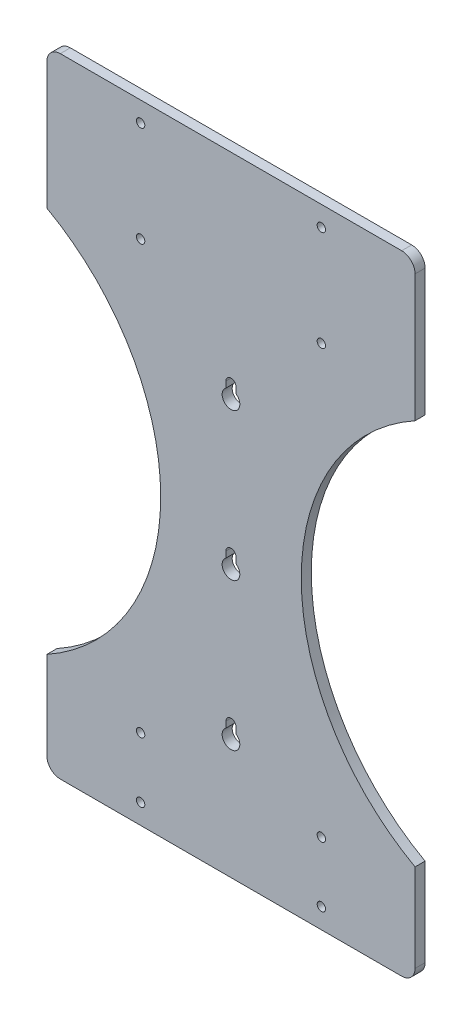
from build123d import *

# Parameters (mm, degrees)
BOSS_EXTRUDE1_DEPTH            = 9.525
V_0_377_DIAMETER_SLOT1_DEPTH   = 9.525
FILLET1_R                      = 12.7
SKETCH6_R                      = 8.382
CUT_EXTRUDE1_DEPTH             = 357.929879318
F_5_16_0_3125_DIAMETER_HOLE1_D = 7.9375
SKETCH14_W                     = 349.25
SKETCH14_H                     = 26.277954941
CUT_EXTRUDE3_DEPTH             = 357.929879318
FILLET2_R                      = 12.7


# Read off the part's stored shape, not the designer's step: V (0.377) Diameter Slot1
with BuildPart() as part:
    # Sketch1 → Boss-Extrude1 (new body)
    with BuildSketch(Plane.XY):
        with BuildLine():
            Line((-174.625, 151.522045059), (-174.625, 311.15))
            Line((-174.625, 311.15), (174.625, 311.15))
            Line((174.625, 311.15), (174.625, 151.522045059))
            ThreePointArc((174.625, 151.522045059), (66.675, -31.75), (174.625, -215.022045059))
            Line((174.625, -215.022045059), (174.625, -311.15))
            Line((174.625, -311.15), (-174.625, -311.15))
            Line((-174.625, -311.15), (-174.625, -215.022045059))
            ThreePointArc((-174.625, -215.022045059), (-66.675, -31.75), (-174.625, 151.522045059))
        make_face()
    extrude(amount=BOSS_EXTRUDE1_DEPTH)

    # V (0.377) Diameter Slot1 outline → V (0.377) Diameter Slot1 (cut)
    with BuildSketch(Plane.XY):
        with BuildLine():
            Line((4.7879, -57.8866), (4.7879, -45.2374))
            ThreePointArc((4.7879, -45.2374), (0, -40.4495), (-4.7879, -45.2374))
            Line((-4.7879, -45.2374), (-4.7879, -57.8866))
            ThreePointArc((-4.7879, -57.8866), (0, -62.6745), (4.7879, -57.8866))
        make_face()
        with BuildLine():
            ThreePointArc((4.7879, 94.4626), (0, 99.2505), (-4.7879, 94.4626))
            Line((-4.7879, 94.4626), (-4.7879, 81.8134))
            ThreePointArc((-4.7879, 81.8134), (0, 77.0255), (4.7879, 81.8134))
            Line((4.7879, 81.8134), (4.7879, 94.4626))
        make_face()
        with BuildLine():
            ThreePointArc((4.7879, -184.9374), (0, -180.1495), (-4.7879, -184.9374))
            Line((-4.7879, -184.9374), (-4.7879, -197.5866))
            ThreePointArc((-4.7879, -197.5866), (0, -202.3745), (4.7879, -197.5866))
            Line((4.7879, -197.5866), (4.7879, -184.9374))
        make_face()
    extrude(amount=V_0_377_DIAMETER_SLOT1_DEPTH, mode=Mode.SUBTRACT)

    # Fillet1
    fillet1_edges = [part.edges().sort_by_distance(p)[0] for p in [
        (174.625, -311.15, 4.7625),
        (-174.625, -311.15, 4.7625),
    ]]
    fillet(fillet1_edges, radius=FILLET1_R)

    # Sketch6 → Cut-Extrude1 (cut, through all)
    with BuildSketch(Plane.XY.offset(9.525)):
        with Locations((0, -197.5866)):
            Circle(SKETCH6_R)
        with Locations((0, 81.8134)):
            Circle(SKETCH6_R)
        with Locations((0, -57.8866)):
            Circle(SKETCH6_R)
    extrude(amount=-CUT_EXTRUDE1_DEPTH, mode=Mode.SUBTRACT)

    # 5/16 (0.3125) Diameter Hole1 (through all)
    with Locations(Plane(origin=(0, 0, 0), x_dir=(-1, 0, 0), z_dir=(0, 0, -1))):
        with Locations((-85.725, 265.938), (85.725, 170.688), (85.725, 265.938), (-85.725, 170.688), (85.725, -234.95), (85.725, -292.1), (-85.725, -292.1), (-85.725, -234.95)):
            Hole(F_5_16_0_3125_DIAMETER_HOLE1_D / 2)

    # Sketch14 → Cut-Extrude3 (cut, through all)
    with BuildSketch(Plane(origin=(0, 0, 0), x_dir=(-1, 0, 0), z_dir=(0, 0, -1))):
        with Locations((0, 298.011022529)):
            Rectangle(SKETCH14_W, SKETCH14_H)
    extrude(amount=-CUT_EXTRUDE3_DEPTH, mode=Mode.SUBTRACT)

    # Fillet2
    fillet2_edges = [part.edges().sort_by_distance(p)[0] for p in [
        (174.625, 284.872045059, 4.7625),
        (-174.625, 284.872045059, 4.7625),
    ]]
    fillet(fillet2_edges, radius=FILLET2_R)


solid = part.part
